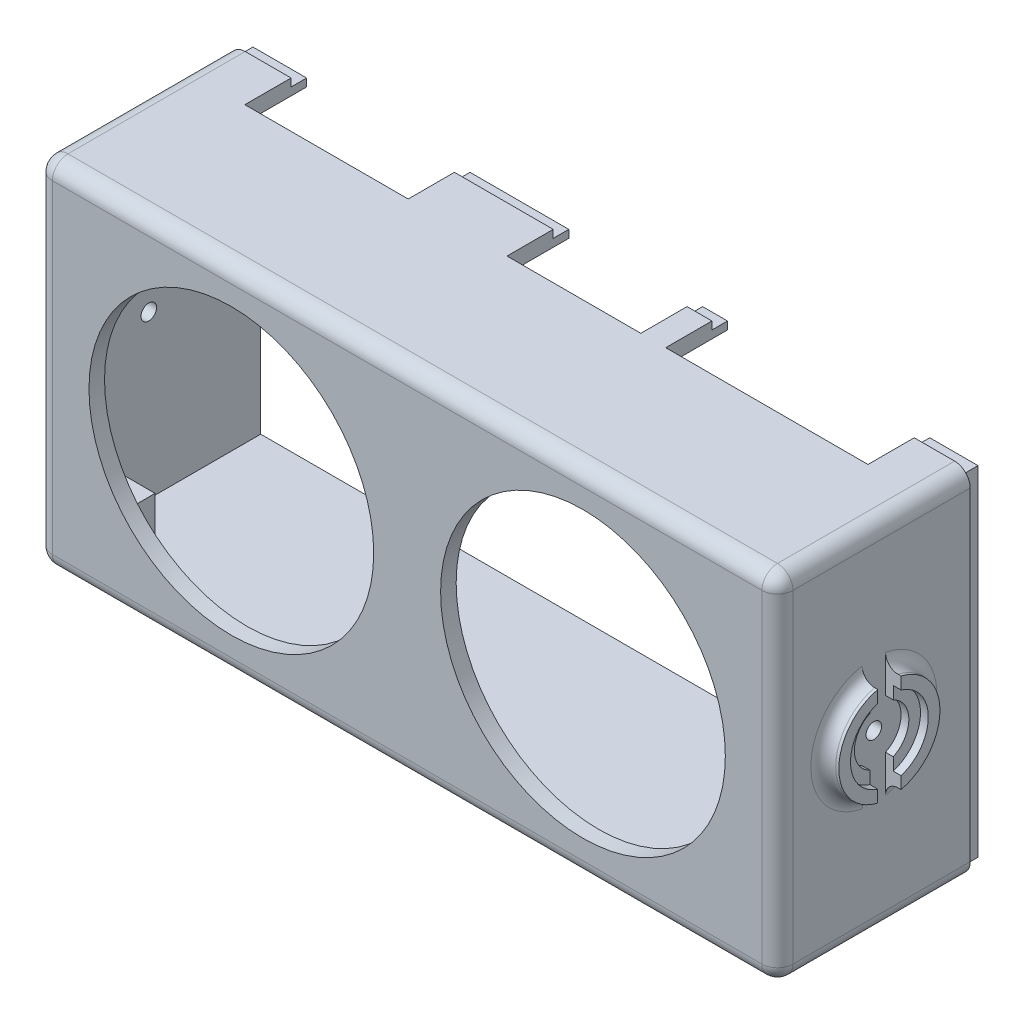
from build123d import *

# Parameters (mm, degrees)
SKETCH_1_W           = 47.600012207
SKETCH_1_H           = 22.800017408
SKETCH_1_W_2         = 45.600012207
SKETCH_1_H_2         = 20.800017408
EXTRUDE_1_DEPTH      = 11.389024732
SKETCH_2_W           = 47.600012207
SKETCH_2_H           = 22.800017408
EXTRUDE_2_DEPTH      = 1
SKETCH_3_R           = 9.15
CUT_EXTRUDE_1_DEPTH  = 1
SKETCH_7_W           = 13
SKETCH_7_H           = 2.971113622
SKETCH_7_W_2         = 8.6
SKETCH_7_H_2         = 2.971113154
SKETCH_7_W_3         = 10.5
SKETCH_7_H_3         = 2.971112957
CUT_EXTRUDE_2_DEPTH  = 1
SKETCH_8_R           = 3.25
SKETCH_8_R_2         = 1.75
EXTRUDE_3_DEPTH      = 1
SKETCH_9_W           = 1.5
SKETCH_9_H           = 6.5
CUT_EXTRUDE_3_DEPTH  = 1
SKETCH_10_R          = 2.5
CUT_EXTRUDE_6_DEPTH  = 0.5
SKETCH_13_R          = 0.5
CUT_EXTRUDE_7_DEPTH  = 1
EXTRUDE_START        = 1
SKETCH_15_R          = 3.25
SKETCH_15_R_2        = 1.75
EXTRUDE_4_DEPTH      = 1
CUT_EXTRUDE_START    = -0.5
SKETCH_16_R          = 2.5
CUT_EXTRUDE_8_DEPTH  = 0.5
SKETCH_17_W          = 1.5
SKETCH_17_H          = 6.5
CUT_EXTRUDE_9_DEPTH  = 1
CUT_EXTRUDE_START_2  = -1
SKETCH_18_R          = 0.5
CUT_EXTRUDE_10_DEPTH = 1
SKETCH_19_W          = 1.599774972
SKETCH_19_H          = 0.5
SKETCH_19_W_2        = 6.350027001
EXTRUDE_5_DEPTH      = 1
FILLET_1_R           = 0.8
FILLET_2_R           = 1
SKETCH_20_W          = 3.099999541
SKETCH_20_H          = 3.199999216
SKETCH_20_R          = 0.7
EXTRUDE_6_DEPTH      = 2.5


with BuildPart() as part:
    # Эскиз1 → Бобышка-Вытянуть1 (new body)
    with BuildSketch(Plane.XY):
        with Locations((-22.600006104, 10.200008704)):
            Rectangle(SKETCH_1_W, SKETCH_1_H)
        with Locations((-22.600006104, 10.200008704)):
            Rectangle(SKETCH_1_W_2, SKETCH_1_H_2, mode=Mode.SUBTRACT)
    extrude(amount=EXTRUDE_1_DEPTH)

    # Эскиз2 → Бобышка-Вытянуть2 (add)
    with BuildSketch(Plane.XY.offset(11.389024732)):
        with Locations((-22.600006104, 10.200008704)):
            Rectangle(SKETCH_2_W, SKETCH_2_H)
    extrude(amount=EXTRUDE_2_DEPTH)

    # Эскиз3 → Вырез-Вытянуть1 (cut)
    with BuildSketch(Plane.XY.offset(12.389024732)):
        with Locations((-11.299998193, 10.200016658)):
            Circle(SKETCH_3_R)
        with Locations((-33.899998193, 10.200013156)):
            Circle(SKETCH_3_R)
    extrude(amount=-CUT_EXTRUDE_1_DEPTH, mode=Mode.SUBTRACT)

    # Эскиз7 → Вырез-Вытянуть2 (cut)
    with BuildSketch(Plane(origin=(0, 21.600017408, 0), x_dir=(1, 0, 0), z_dir=(0, 1, 0))):
        with Locations((-8.900084477, -1.485556811)):
            Rectangle(SKETCH_7_W, SKETCH_7_H)
        with Locations((-21.299859449, -1.485556577)):
            Rectangle(SKETCH_7_W_2, SKETCH_7_H_2)
        with Locations((-37.19988645, -1.485556479)):
            Rectangle(SKETCH_7_W_3, SKETCH_7_H_3)
    extrude(amount=-CUT_EXTRUDE_2_DEPTH, mode=Mode.SUBTRACT)

    # Эскиз8 → Бобышка-Вытянуть3 (add)
    with BuildSketch(Plane(origin=(1.2, 0, 0), x_dir=(0, 0, -1), z_dir=(1, 0, 0))):
        with Locations((-6.194512366, 10.200008704)):
            Circle(SKETCH_8_R)
        with Locations((-6.194512366, 10.200008704)):
            Circle(SKETCH_8_R_2, mode=Mode.SUBTRACT)
    extrude(amount=EXTRUDE_3_DEPTH)

    # Эскиз9 → Вырез-Вытянуть3 (cut)
    with BuildSketch(Plane(origin=(2.2, 0, 0), x_dir=(0, 0, -1), z_dir=(1, 0, 0))):
        with Locations((-6.194512366, 10.200008704)):
            Rectangle(SKETCH_9_W, SKETCH_9_H)
    extrude(amount=-CUT_EXTRUDE_3_DEPTH, mode=Mode.SUBTRACT)

    # Эскиз10 → Вырез-Вытянуть6 (cut)
    with BuildSketch(Plane(origin=(2.2, 0, 0), x_dir=(0, 0, -1), z_dir=(1, 0, 0))):
        with Locations((-6.194512366, 10.200008704)):
            Circle(SKETCH_10_R)
    extrude(amount=-CUT_EXTRUDE_6_DEPTH, mode=Mode.SUBTRACT)

    # Эскиз13 → Вырез-Вытянуть7 (cut)
    with BuildSketch(Plane(origin=(1.2, 0, 0), x_dir=(0, 0, -1), z_dir=(1, 0, 0))):
        with Locations((-6.194512366, 10.200008704)):
            Circle(SKETCH_13_R)
    extrude(amount=-CUT_EXTRUDE_7_DEPTH, mode=Mode.SUBTRACT)

    # Эскиз15 → Бобышка-Вытянуть4 (add)
    with BuildSketch(Plane.ZY.offset(46.400012207).offset(EXTRUDE_START)):
        with Locations((6.194512366, 10.200008704)):
            Circle(SKETCH_15_R)
        with Locations((6.194512366, 10.200008704)):
            Circle(SKETCH_15_R_2, mode=Mode.SUBTRACT)
    extrude(amount=-EXTRUDE_4_DEPTH)

    # Эскиз16 → Вырез-Вытянуть8 (cut)
    with BuildSketch(Plane.ZY.offset(47.400012207).offset(CUT_EXTRUDE_START)):
        with Locations((6.194512366, 10.200008704)):
            Circle(SKETCH_16_R)
    extrude(amount=CUT_EXTRUDE_8_DEPTH, mode=Mode.SUBTRACT)

    # Эскиз17 → Вырез-Вытянуть9 (cut)
    with BuildSketch(Plane.ZY.offset(47.400012207)):
        with Locations((6.194512366, 10.200008704)):
            Rectangle(SKETCH_17_W, SKETCH_17_H)
    extrude(amount=-CUT_EXTRUDE_9_DEPTH, mode=Mode.SUBTRACT)

    # Эскиз18 → Вырез-Вытянуть10 (cut)
    with BuildSketch(Plane.ZY.offset(46.400012207).offset(CUT_EXTRUDE_START_2)):
        with Locations(Location((6.194512366, 10.200008704, 0), (0, 0, 180))):
            Circle(SKETCH_18_R)
    extrude(amount=CUT_EXTRUDE_10_DEPTH, mode=Mode.SUBTRACT)

    # Эскиз19 → Бобышка-Вытянуть5 (add)
    with BuildSketch(Plane(origin=(0, 0, 0), x_dir=(-1, 0, 0), z_dir=(0, 0, -1))):
        with Locations((16.199971963, 20.850017408)):
            Rectangle(SKETCH_19_W, SKETCH_19_H)
        Polygon((45.400012207, -0.2), (-0.2, -0.2), (-0.2, 20.600017408), (2.400084477, 20.600017408), (2.400084477, 21.100017408), (-0.7, 21.100017408), (-0.7, -0.7), (45.900012207, -0.7), (45.900012207, 21.100017408), (42.44988645, 21.100017408), (42.44988645, 20.600017408), (45.400012207, 20.600017408), align=None)
        with Locations((28.77487295, 20.850017408)):
            Rectangle(SKETCH_19_W_2, SKETCH_19_H)
    extrude(amount=EXTRUDE_5_DEPTH)

    # Скругление1
    # the kernel refuses this fillet: 0.8 mm, written as the material it adds along each edge
    with BuildSketch(Plane(origin=(1.2, 10.200008704, 6.194512366), x_dir=(0, 0.9274601532021158, -0.3739220028592966), z_dir=(0, -0.3739220028592966, -0.9274601532021158))) as fillet_1_piece_1_section:
        with BuildLine():
            CenterArc((3.25 + FILLET_1_R, FILLET_1_R), FILLET_1_R, 180, 90)
            Line((3.25, FILLET_1_R), (3.25, 0))
            Line((3.25, 0), (3.25 + FILLET_1_R, 0))
        make_face()
    fillet_1_piece_1 = revolve(axis=Axis((1.2, 10.200008704, 6.194512366), (1, 0, 0)), revolution_arc=223.915403392, mode=Mode.PRIVATE)
    fillet_1_piece_1 = split(fillet_1_piece_1, bisect_by=Plane(origin=(1.369516768, 13.485333566, 5.444512366), z_dir=(0, 0, -1)), keep=Keep.TOP, mode=Mode.PRIVATE)
    add(fillet_1_piece_1)
    with BuildSketch(Plane(origin=(1.2, 10.200008704, 6.194512366), x_dir=(0, 0.9274601532021158, -0.3739220028592966), z_dir=(0, -0.3739220028592966, -0.9274601532021158))) as fillet_1_piece_2_section:
        with BuildLine():
            CenterArc((3.25 + FILLET_1_R, FILLET_1_R), FILLET_1_R, 180, 90)
            Line((3.25, FILLET_1_R), (3.25, 0))
            Line((3.25, 0), (3.25 + FILLET_1_R, 0))
        make_face()
    fillet_1_piece_2 = revolve(axis=Axis((1.2, 10.200008704, 6.194512366), (1, 0, 0)), revolution_arc=223.915403392, mode=Mode.PRIVATE)
    fillet_1_piece_2 = split(fillet_1_piece_2, bisect_by=Plane(origin=(1.426653651, 10.200008704, 6.944512366), z_dir=(0, 0, 1)), keep=Keep.TOP, mode=Mode.PRIVATE)
    add(fillet_1_piece_2)
    with BuildSketch(Plane(origin=(1.2, 10.200008704, 6.194512366), x_dir=(0, 0.9274601532021, 0.37392200285933624), z_dir=(0, -0.37392200285933624, 0.9274601532021))) as fillet_1_piece_3_section:
        with BuildLine():
            CenterArc((3.25 + FILLET_1_R, -FILLET_1_R), FILLET_1_R, 90, 90)
            Line((3.25, -FILLET_1_R), (3.25, 0))
            Line((3.25, 0), (3.25 + FILLET_1_R, 0))
        make_face()
    fillet_1_piece_3 = revolve(axis=Axis((1.2, 10.200008704, 6.194512366), (-1, 0, 0)), revolution_arc=223.915403392, mode=Mode.PRIVATE)
    fillet_1_piece_3 = split(fillet_1_piece_3, bisect_by=Plane(origin=(1.369517053, 13.485333689, 6.944512366), z_dir=(0, 0, 1)), keep=Keep.TOP, mode=Mode.PRIVATE)
    add(fillet_1_piece_3)
    with BuildSketch(Plane(origin=(1.2, 10.200008704, 6.194512366), x_dir=(0, 0.9274601532021, 0.37392200285933624), z_dir=(0, -0.37392200285933624, 0.9274601532021))) as fillet_1_piece_4_section:
        with BuildLine():
            CenterArc((3.25 + FILLET_1_R, -FILLET_1_R), FILLET_1_R, 90, 90)
            Line((3.25, -FILLET_1_R), (3.25, 0))
            Line((3.25, 0), (3.25 + FILLET_1_R, 0))
        make_face()
    fillet_1_piece_4 = revolve(axis=Axis((1.2, 10.200008704, 6.194512366), (-1, 0, 0)), revolution_arc=223.915403392, mode=Mode.PRIVATE)
    fillet_1_piece_4 = split(fillet_1_piece_4, bisect_by=Plane(origin=(1.426653651, 10.200008704, 5.444512366), z_dir=(0, 0, -1)), keep=Keep.TOP, mode=Mode.PRIVATE)
    add(fillet_1_piece_4)
    with BuildSketch(Plane(origin=(-46.400012207, 10.200008704, 6.194512366), x_dir=(0, 0.9274601532021159, 0.3739220028592964), z_dir=(0, -0.3739220028592964, 0.9274601532021159))) as fillet_1_piece_5_section:
        with BuildLine():
            CenterArc((3.25 + FILLET_1_R, FILLET_1_R), FILLET_1_R, 180, 90)
            Line((3.25, FILLET_1_R), (3.25, 0))
            Line((3.25, 0), (3.25 + FILLET_1_R, 0))
        make_face()
    fillet_1_piece_5 = revolve(axis=Axis((-46.400012207, 10.200008704, 6.194512366), (-1, 0, 0)), revolution_arc=223.915403392, mode=Mode.PRIVATE)
    fillet_1_piece_5 = split(fillet_1_piece_5, bisect_by=Plane(origin=(-46.56952926, 13.485333689, 6.944512366), z_dir=(0, 0, 1)), keep=Keep.TOP, mode=Mode.PRIVATE)
    add(fillet_1_piece_5)
    with BuildSketch(Plane(origin=(-46.400012207, 10.200008704, 6.194512366), x_dir=(0, 0.9274601532021159, 0.3739220028592964), z_dir=(0, -0.3739220028592964, 0.9274601532021159))) as fillet_1_piece_6_section:
        with BuildLine():
            CenterArc((3.25 + FILLET_1_R, FILLET_1_R), FILLET_1_R, 180, 90)
            Line((3.25, FILLET_1_R), (3.25, 0))
            Line((3.25, 0), (3.25 + FILLET_1_R, 0))
        make_face()
    fillet_1_piece_6 = revolve(axis=Axis((-46.400012207, 10.200008704, 6.194512366), (-1, 0, 0)), revolution_arc=223.915403392, mode=Mode.PRIVATE)
    fillet_1_piece_6 = split(fillet_1_piece_6, bisect_by=Plane(origin=(-46.626665858, 10.200008704, 5.444512366), z_dir=(0, 0, -1)), keep=Keep.TOP, mode=Mode.PRIVATE)
    add(fillet_1_piece_6)
    with BuildSketch(Plane(origin=(-46.400012207, 10.200008704, 6.194512366), x_dir=(0, 0.9274601532020997, -0.3739220028593366), z_dir=(0, -0.3739220028593366, -0.9274601532020997))) as fillet_1_piece_7_section:
        with BuildLine():
            CenterArc((3.25 + FILLET_1_R, -FILLET_1_R), FILLET_1_R, 90, 90)
            Line((3.25, -FILLET_1_R), (3.25, 0))
            Line((3.25, 0), (3.25 + FILLET_1_R, 0))
        make_face()
    fillet_1_piece_7 = revolve(axis=Axis((-46.400012207, 10.200008704, 6.194512366), (1, 0, 0)), revolution_arc=223.915403392, mode=Mode.PRIVATE)
    fillet_1_piece_7 = split(fillet_1_piece_7, bisect_by=Plane(origin=(-46.569528975, 13.485333566, 5.444512366), z_dir=(0, 0, -1)), keep=Keep.TOP, mode=Mode.PRIVATE)
    add(fillet_1_piece_7)
    with BuildSketch(Plane(origin=(-46.400012207, 10.200008704, 6.194512366), x_dir=(0, 0.9274601532020997, -0.3739220028593366), z_dir=(0, -0.3739220028593366, -0.9274601532020997))) as fillet_1_piece_8_section:
        with BuildLine():
            CenterArc((3.25 + FILLET_1_R, -FILLET_1_R), FILLET_1_R, 90, 90)
            Line((3.25, -FILLET_1_R), (3.25, 0))
            Line((3.25, 0), (3.25 + FILLET_1_R, 0))
        make_face()
    fillet_1_piece_8 = revolve(axis=Axis((-46.400012207, 10.200008704, 6.194512366), (1, 0, 0)), revolution_arc=223.915403392, mode=Mode.PRIVATE)
    fillet_1_piece_8 = split(fillet_1_piece_8, bisect_by=Plane(origin=(-46.626665858, 10.200008704, 6.944512366), z_dir=(0, 0, 1)), keep=Keep.TOP, mode=Mode.PRIVATE)
    add(fillet_1_piece_8)

    # Скругление2
    fillet_2_edges = [part.edges().sort_by_distance(p)[0] for p in [
        (1.2, -1.2, 6.194512366),
        (1.2, 10.200008704, 12.389024732),
        (-22.600006104, 21.600017408, 12.389024732),
        (-46.400012207, 10.200008704, 12.389024732),
        (-22.600006104, -1.2, 12.389024732),
        (1.2, 21.600017408, 6.194512366),
        (-46.400012207, 21.600017408, 6.194512366),
        (-46.400012207, -1.2, 6.194512366),
    ]]
    fillet(fillet_2_edges, radius=FILLET_2_R)

    # Эскиз20 → Бобышка-Вытянуть6 (add)
    # profile 1 of 4: a face of its own
    with BuildSketch(Plane(origin=(0, 0, 11.389024732), x_dir=(-1, 0, 0), z_dir=(0, 0, -1))):
        with Locations((1.34999977, 19.0000178)):
            Rectangle(SKETCH_20_W, SKETCH_20_H)
        with Locations((1.399999541, 18.900018192)):
            Circle(SKETCH_20_R, mode=Mode.SUBTRACT)
    # profile 2 of 4: a face of its own
    with BuildSketch(Plane(origin=(0, 0, 11.389024732), x_dir=(-1, 0, 0), z_dir=(0, 0, -1))):
        with Locations((1.34999977, 1.399999608)):
            Rectangle(SKETCH_20_W, SKETCH_20_H)
        with Locations(Location((1.399999541, 1.499999216, 0), (0, 0, 180))):
            Circle(SKETCH_20_R, mode=Mode.SUBTRACT)
    # profile 3 of 4: a face of its own
    with BuildSketch(Plane(origin=(0, 0, 11.389024732), x_dir=(-1, 0, 0), z_dir=(0, 0, -1))):
        with Locations((43.849992032, 1.399999608)):
            Rectangle(SKETCH_20_W, SKETCH_20_H)
        with Locations((43.799992261, 1.499999216)):
            Circle(SKETCH_20_R, mode=Mode.SUBTRACT)
    # profile 4 of 4: a face of its own
    with BuildSketch(Plane(origin=(0, 0, 11.389024732), x_dir=(-1, 0, 0), z_dir=(0, 0, -1))):
        with Locations((43.849992032, 19.0000178)):
            Rectangle(SKETCH_20_W, SKETCH_20_H)
        with Locations(Location((43.799992261, 18.900018192, 0), (0, 0, 180))):
            Circle(SKETCH_20_R, mode=Mode.SUBTRACT)
    extrude(amount=EXTRUDE_6_DEPTH)


solid = part.part
